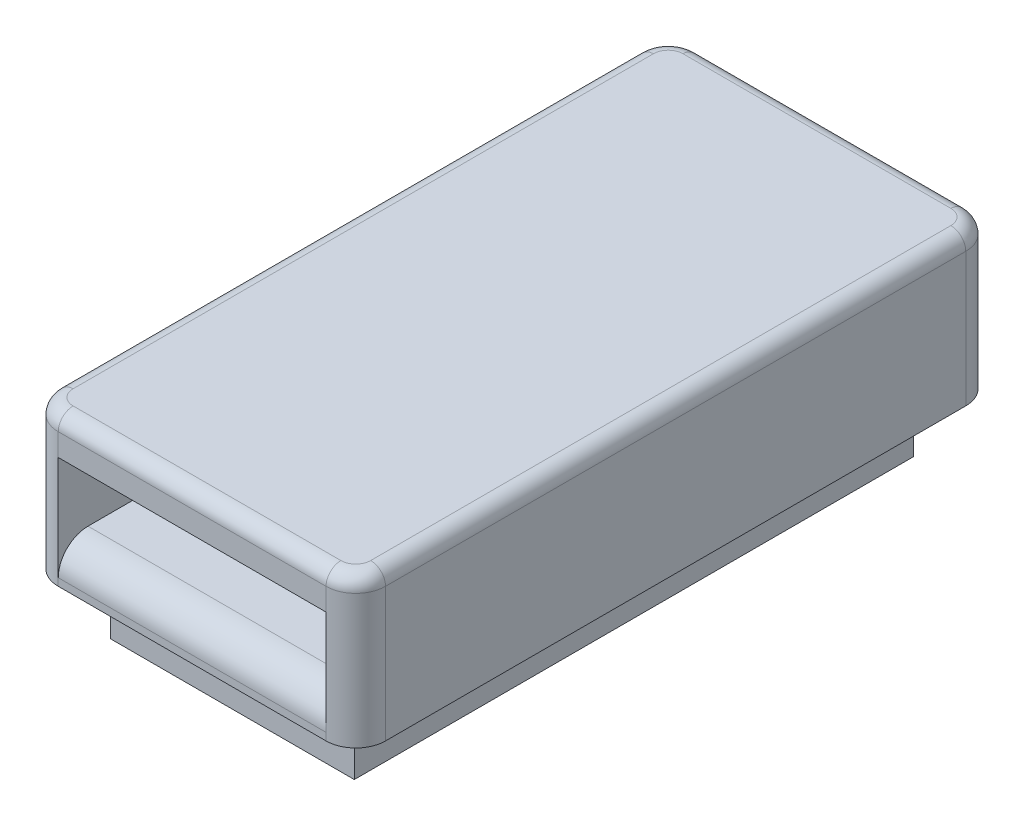
from build123d import *

# Parameters (mm, degrees)
BOSS_EXTRUDE1_DEPTH = 10
SKETCH1_4_W         = 16.4
SKETCH1_4_H         = 37.6
BOSS_EXTRUDE2_DEPTH = 4
SKETCH3_W           = 18
SKETCH3_H           = 5
CUT_EXTRUDE2_DEPTH  = 70.74955197
FILLET2_R           = 1
FILLET3_R           = 2


with BuildPart() as part:
    # Sketch1 → Boss-Extrude1 (new body)
    with BuildSketch(Plane(origin=(0, 0, 0), x_dir=(1, 0, 0), z_dir=(0, 1, 0))):
        with BuildLine():
            Line((-9, -21.5), (9, -21.5))
            ThreePointArc((9, -21.5), (10.414213562, -20.914213562), (11, -19.5))
            Line((11, -19.5), (11, 19.5))
            ThreePointArc((11, 19.5), (10.414213562, 20.914213562), (9, 21.5))
            Line((9, 21.5), (-9, 21.5))
            ThreePointArc((-9, 21.5), (-10.414213562, 20.914213562), (-11, 19.5))
            Line((-11, 19.5), (-11, -19.5))
            ThreePointArc((-11, -19.5), (-10.414213562, -20.914213562), (-9, -21.5))
        make_face()
    extrude(amount=BOSS_EXTRUDE1_DEPTH)

    # Sketch1<4> → Boss-Extrude2 (add)
    with BuildSketch(Plane(origin=(0, 0, 0), x_dir=(1, 0, 0), z_dir=(0, 1, 0))):
        Rectangle(SKETCH1_4_W, SKETCH1_4_H)
    extrude(amount=-BOSS_EXTRUDE2_DEPTH)

    # Sketch3 → Cut-Extrude2 (cut, through all)
    with BuildSketch(Plane(origin=(-43, 0, -21.5), x_dir=(1, 0, 0), z_dir=(0, 0, 1))):
        with Locations((43, 5)):
            Rectangle(SKETCH3_W, SKETCH3_H)
    extrude(amount=CUT_EXTRUDE2_DEPTH, mode=Mode.SUBTRACT)

    # Fillet2
    fillet2_edges = [part.edges().sort_by_distance(p)[0] for p in [
        (10.414213562, 10, -20.914213562),
        (11, 10, 0),
        (10.414213562, 10, 20.914213562),
        (0, 10, 21.5),
        (-10.414213562, 10, 20.914213562),
        (-11, 10, 0),
        (-10.414213562, 10, -20.914213562),
        (0, 10, -21.5),
    ]]
    fillet(fillet2_edges, radius=FILLET2_R)

    # Fillet3
    # the kernel refuses this fillet: 2 mm, written as the material it takes off along each edge
    with BuildSketch(Plane(origin=(9, 2.5, -21.5), x_dir=(0, -1, 0), z_dir=(-1, 0, 0))) as fillet3_piece_1:
        with BuildLine():
            CenterArc((FILLET3_R, FILLET3_R), FILLET3_R, 180, 90)
            Line((0, FILLET3_R), (0, 0))
            Line((0, 0), (FILLET3_R, 0))
        make_face()
    extrude(amount=18, mode=Mode.SUBTRACT)
    with BuildSketch(Plane(origin=(9, 2.5, 21.5), x_dir=(0, -1, 0), z_dir=(-1, 0, 0))) as fillet3_piece_2:
        with BuildLine():
            CenterArc((FILLET3_R, -FILLET3_R), FILLET3_R, 90, 90)
            Line((0, -FILLET3_R), (0, 0))
            Line((0, 0), (FILLET3_R, 0))
        make_face()
    extrude(amount=18, mode=Mode.SUBTRACT)


solid = part.part
